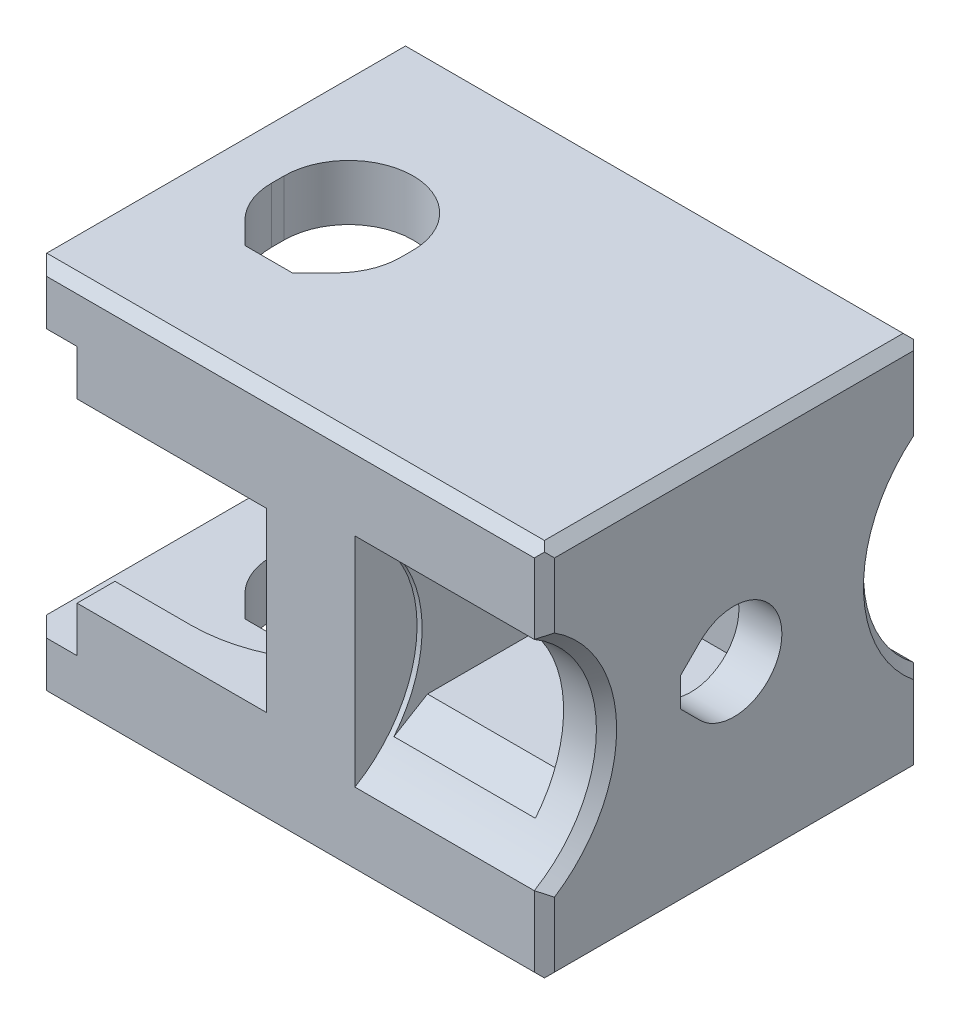
from build123d import *

# Parameters (mm, degrees)
SKETCH_1_W               = 20.5
SKETCH_1_H               = 15
EXTRUDE_1_DEPTH          = 15
CUT_EXTRUDE_1_DEPTH      = 27.485845276
CUT_EXTRUDE_1_DEPTH_BACK = 7.5
SKETCH_2_R               = 5
SKETCH_4_W               = 5.6
SKETCH_4_H               = 4.7
CUT_EXTRUDE_4_DEPTH      = 10
SKETCH_5_W               = 9.5
SKETCH_5_H               = 7
CUT_EXTRUDE_5_DEPTH      = 20.654834011
CUT_EXTRUDE_2_DEPTH      = 7.3
CUT_EXTRUDE_6_DEPTH      = 24.55976443
CUT_EXTRUDE_START        = -1.8
CUT_EXTRUDE_7_DEPTH      = 10.6
SKETCH_11_W              = 15.106844648
SKETCH_11_H              = 10.6
CUT_EXTRUDE_8_DEPTH      = 2
SKETCH_12_R              = 7.5
CUT_EXTRUDE_9_DEPTH      = 7
CHAMFER_1_SIZE           = 0.4
CHAMFER_2_SIZE           = 0.4
CHAMFER_4_SIZE           = 0.8
CHAMFER_7_SIZE           = 0.8
CHAMFER_8_SIZE           = 0.4


# Some blends are built 0.0001 mm under size
with BuildPart() as part:
    # 草图1 → 凸台-拉伸1 (new body)
    with BuildSketch(Plane.XY):
        Rectangle(SKETCH_1_W, SKETCH_1_H)
    extrude(amount=EXTRUDE_1_DEPTH)

    # 草图2 → 切除-拉伸1 (cut, two sides: drawn at the far end of the back side and taken through both)
    with BuildSketch(Plane(origin=(10.25, 0, 0), x_dir=(0, 0, -1), z_dir=(1, 0, 0)).offset(-CUT_EXTRUDE_1_DEPTH_BACK)):
        with Locations((-17.541169992, 0)):
            Circle(SKETCH_2_R)
        with Locations((3.030989937, 0)):
            Circle(SKETCH_2_R)
    extrude(amount=CUT_EXTRUDE_1_DEPTH + CUT_EXTRUDE_1_DEPTH_BACK, mode=Mode.SUBTRACT)

    # 草图4 → 切除-拉伸4 (cut)
    with BuildSketch(Plane.XY.offset(15)):
        with Locations((5.75, 0)):
            Rectangle(SKETCH_4_W, SKETCH_4_H)
    extrude(amount=-CUT_EXTRUDE_4_DEPTH, mode=Mode.SUBTRACT)

    # 草图5 → 切除-拉伸5 (cut, through all)
    with BuildSketch(Plane.XY.offset(15)):
        with Locations((-5.5, 0)):
            Rectangle(SKETCH_5_W, SKETCH_5_H)
    extrude(amount=-CUT_EXTRUDE_5_DEPTH, mode=Mode.SUBTRACT)

    # 草图3 → 切除-拉伸2 (cut)
    with BuildSketch(Plane(origin=(10.25, 0, 0), x_dir=(0, 0, -1), z_dir=(1, 0, 0))):
        with BuildLine():
            Line((-9.612291748, -0.57471402), (-8.843502884, -1.343502884))
            ThreePointArc((-8.843502884, -1.343502884), (-5.6, 0), (-8.843502884, 1.343502884))
            Line((-8.843502884, 1.343502884), (-9.612291748, 0.57471402))
            Line((-9.612291748, 0.57471402), (-9.612291748, -0.57471402))
        make_face()
    extrude(amount=-CUT_EXTRUDE_2_DEPTH, mode=Mode.SUBTRACT)

    # 草图9 → 切除-拉伸6 (cut, through all)
    with BuildSketch(Plane(origin=(0, 7.5, 0), x_dir=(1, 0, 0), z_dir=(0, 1, 0))):
        with BuildLine():
            Line((-7.8, -7.25), (-7.8, -7.75))
            ThreePointArc((-7.8, -7.75), (-7.605892808, -8.725842753), (-7.053122292, -9.553122292))
            Line((-7.053122292, -9.553122292), (-6.188762276, -10.417482308))
            Line((-6.188762276, -10.417482308), (-4.311237724, -10.417482308))
            Line((-4.311237724, -10.417482308), (-3.446877708, -9.553122292))
            ThreePointArc((-3.446877708, -9.553122292), (-2.894107192, -8.725842753), (-2.7, -7.75))
            Line((-2.7, -7.75), (-2.7, -7.25))
            ThreePointArc((-2.7, -7.25), (-5.25, -4.7), (-7.8, -7.25))
        make_face()
    extrude(amount=-CUT_EXTRUDE_6_DEPTH, mode=Mode.SUBTRACT)

    # 草图10 → 切除-拉伸7 (cut)
    with BuildSketch(Plane.XZ.offset(-3.5).offset(CUT_EXTRUDE_START)):
        with BuildLine():
            Line((-5.25, 13.5), (-10.25, 13.5))
            Line((-10.25, 13.5), (-10.25, 1.5))
            Line((-10.25, 1.5), (-5.25, 1.5))
            ThreePointArc((-5.25, 1.5), (0.75, 7.5), (-5.25, 13.5))
        make_face()
    extrude(amount=CUT_EXTRUDE_7_DEPTH, mode=Mode.SUBTRACT)

    # 草图11 → 切除-拉伸8 (cut)
    with BuildSketch(Plane.ZY.offset(10.25)):
        with Locations((7.446577676, 0)):
            Rectangle(SKETCH_11_W, SKETCH_11_H)
    extrude(amount=-CUT_EXTRUDE_8_DEPTH, mode=Mode.SUBTRACT)

    # 草图12 → 切除-拉伸9 (cut)
    with BuildSketch(Plane.XZ.offset(-3.5)):
        with Locations((-5.25, 7.5)):
            Circle(SKETCH_12_R)
    extrude(amount=CUT_EXTRUDE_9_DEPTH, mode=Mode.SUBTRACT)

    # 倒角1
    chamfer_1_edges = [part.edges().sort_by_distance(p)[0] for p in [
        (10.25, 5.903047554, 15),
        (10.25, -5.738284436, 0),
        (10.25, -5.903047554, 15),
        (10.25, 0, 12.541169992),
        (10.25, 0, 1.969010063),
        (10.25, 5.738284436, 0),
        (10.25, 7.5, 7.5),
        (10.25, -7.5, 7.5),
    ]]
    chamfer(chamfer_1_edges, length=CHAMFER_1_SIZE)

    # 倒角2
    chamfer_2_edges = [part.edges().sort_by_distance(p)[0] for p in [
        (-0.2, 7.5, 15),
        (-0.2, 7.5, 0),
        (-0.2, -7.5, 0),
        (-10.25, 7.5, 7.5),
        (-10.25, -7.5, 7.5),
        (-0.2, -7.5, 15),
    ]]
    chamfer(chamfer_2_edges, length=CHAMFER_2_SIZE)

    # 倒角4
    chamfer_4_edges = [part.edges().sort_by_distance(p)[0] for p in [
        (-10.25, 6.2, 0),
        (-10.25, -6.2, 0),
        (-10.25, -6.2, 15),
        (-10.25, 6.2, 15),
    ]]
    chamfer(chamfer_4_edges, length=CHAMFER_4_SIZE - 0.0001)  # a hair under: the kernel refuses the full size

    # 倒角7
    # the kernel refuses this chamfer: 0.8 mm, written as the material it takes off along each edge
    with BuildSketch(Plane(origin=(2.95, -2.35, 13.127837918), x_dir=(0, -0.8336429325250914, 0.5523037760607525), z_dir=(1, 0, 0))) as chamfer_7_piece_1:
        with BuildLine():
            Line((0.956878157, 0), (-CHAMFER_7_SIZE * 0.552303776061, CHAMFER_7_SIZE * 0.833642932525))
            Line((-CHAMFER_7_SIZE * 0.552303776061, CHAMFER_7_SIZE * 0.833642932525), (0, 0))
            ThreePointArc((0, 0), (0.492968028, 0.022921924), (0.956878157, 0))
        make_face()
    extrude(amount=5.6, mode=Mode.SUBTRACT)
    with BuildSketch(Plane(origin=(2.95, 2.35, 13.127837918), x_dir=(0, 0.8336429325250913, 0.5523037760607528), z_dir=(1, 0, 0))) as chamfer_7_piece_2:
        with BuildLine():
            Line((0.956878157, 0), (-CHAMFER_7_SIZE * 0.552303776061, -CHAMFER_7_SIZE * 0.833642932525))
            Line((-CHAMFER_7_SIZE * 0.552303776061, -CHAMFER_7_SIZE * 0.833642932525), (0, 0))
            ThreePointArc((0, 0), (0.492968028, -0.022921924), (0.956878157, 0))
        make_face()
    extrude(amount=5.6, mode=Mode.SUBTRACT)

    # 倒角8
    chamfer_8_edges = [part.edges().sort_by_distance(p)[0] for p in [
        (2.75, 0, 0),
        (-4.5, -3.5, 0),
        (-0.75, 0, 0),
        (-4.5, 3.5, 0),
    ]]
    chamfer(chamfer_8_edges, length=CHAMFER_8_SIZE)


solid = part.part
